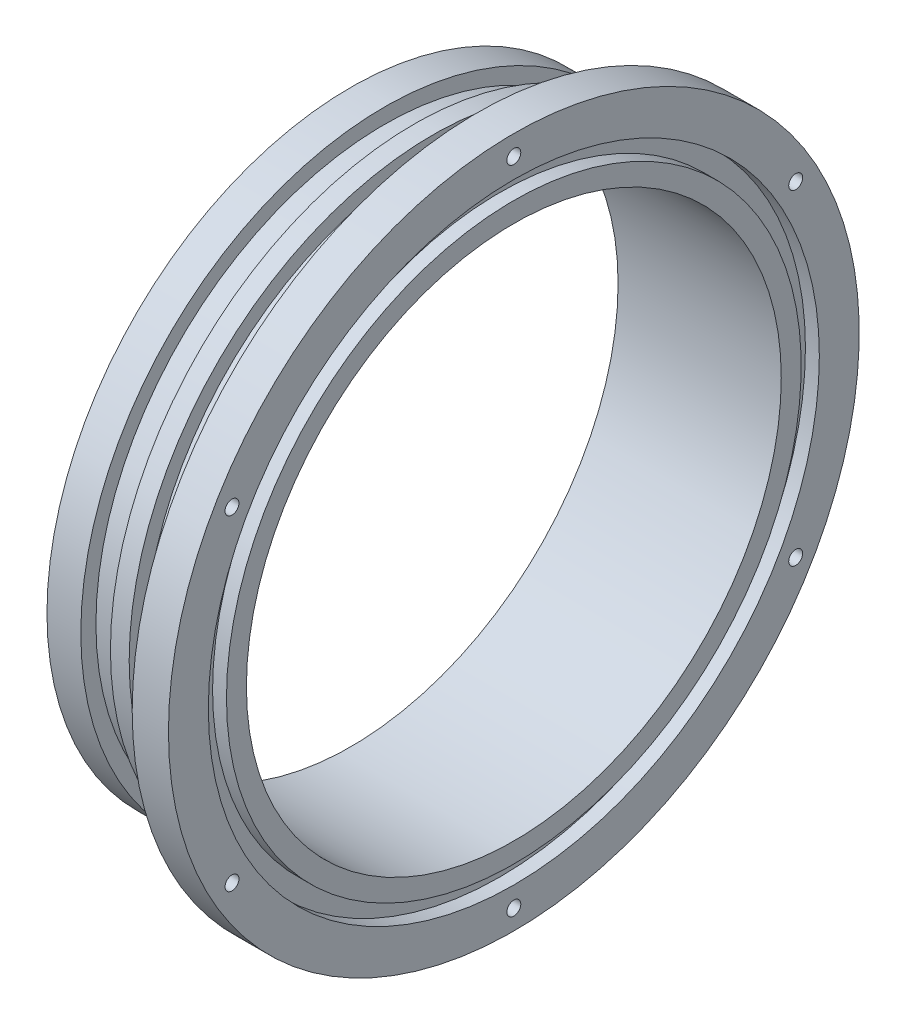
from build123d import *

# Parameters (mm, degrees)
ESQUISSE2_R             = 1.15
ENL_V_MAT_EXTRU_1_DEPTH = 86.212939158
ESQUISSE3_R             = 1.15
ENL_V_MAT_EXTRU_2_DEPTH = 5


with BuildPart() as part:
    # Esquisse1 → Révolution1 (revolve)
    with BuildSketch(Plane.XY):
        Polygon((0, 44.25), (27, 44.25), (27, 47.55), (24.7, 47.55), (24.7, 50.55), (27, 50.55), (27, 57.15), (21, 57.15), (21, 50.25), (18.4, 50.25), (18.4, 47.75), (13.6, 47.75), (13.6, 50.25), (10.5, 50.25), (10.5, 47.75), (5.6, 47.75), (5.6, 50.25), (0, 50.25), align=None)
    revolve(axis=Axis((0, 0, 0), (1, 0, 0)))

    # Esquisse2 → Enlèv. mat.-Extru.1 (cut, through all)
    with BuildSketch(Plane(origin=(27, 0, 0), x_dir=(0, 0, -1), z_dir=(1, 0, 0))):
        with Locations((0, 53.85)):
            Circle(ESQUISSE2_R)
        with Locations((46.635467994, 26.925)):
            Circle(ESQUISSE2_R)
        with Locations((46.635467994, -26.925)):
            Circle(ESQUISSE2_R)
        with Locations((0, -53.85)):
            Circle(ESQUISSE2_R)
        with Locations((-46.635467994, -26.925)):
            Circle(ESQUISSE2_R)
        with Locations((-46.635467994, 26.925)):
            Circle(ESQUISSE2_R)
    extrude(amount=-ENL_V_MAT_EXTRU_1_DEPTH, mode=Mode.SUBTRACT)

    # Esquisse3 → Enlèv. mat.-Extru.2 (cut)
    with BuildSketch(Plane.ZY):
        with Locations((0, -47)):
            Circle(ESQUISSE3_R)
        with Locations((-47, 0)):
            Circle(ESQUISSE3_R)
        with Locations((0, 47)):
            Circle(ESQUISSE3_R)
        with Locations((47, 0)):
            Circle(ESQUISSE3_R)
    extrude(amount=-ENL_V_MAT_EXTRU_2_DEPTH, mode=Mode.SUBTRACT)


solid = part.part
